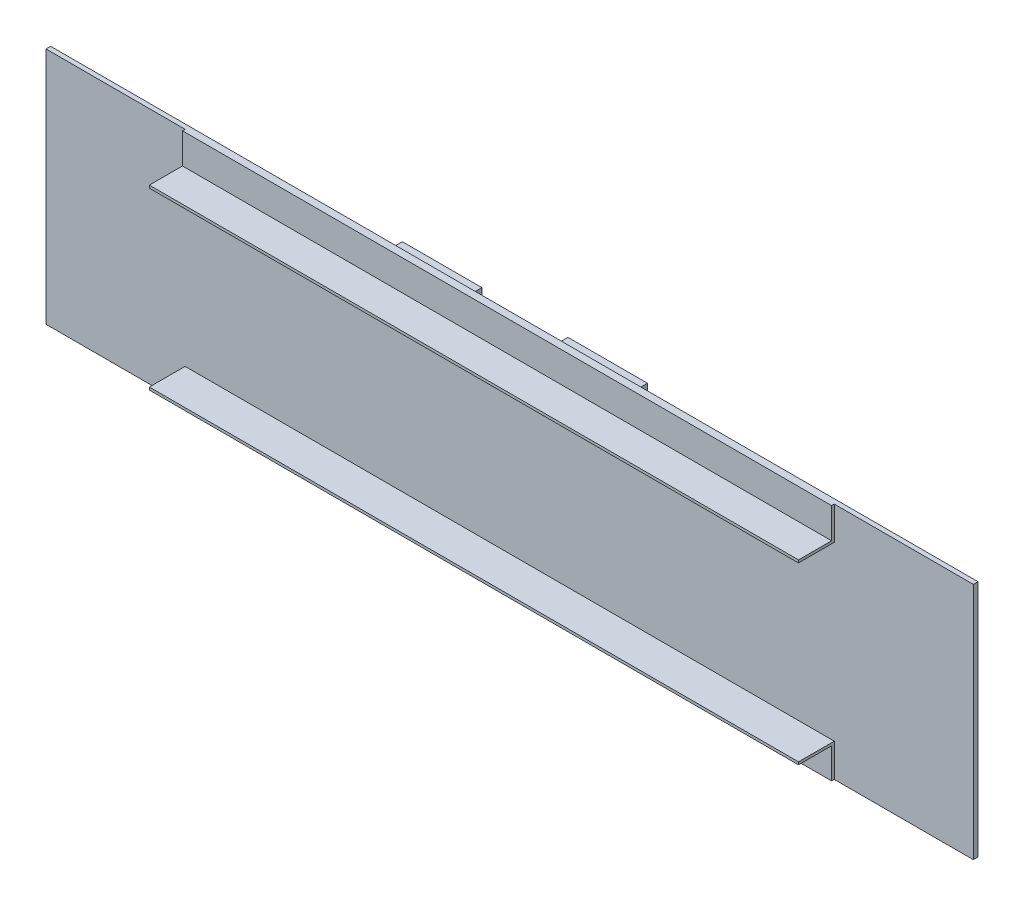
from build123d import *

# Parameters (mm, degrees)
SKETCH_1_W               = 2800
SKETCH_1_H               = 720
EXTRUDE_1_DEPTH          = 14
SKETCH_5_W               = 980
SKETCH_5_H               = 100
EXTRUDE_2_DEPTH          = 8
SKETCH_9_W               = 980
SKETCH_9_H               = 8
EXTRUDE_3_DEPTH          = 100
MIRROR_4_COPY_1_SKETCH_W = 980
MIRROR_4_COPY_1_SKETCH_H = 100
MIRROR_4_COPY_1_DEPTH    = 8
MIRROR_4_COPY_2_SKETCH_W = 980
MIRROR_4_COPY_2_SKETCH_H = 8
MIRROR_4_COPY_2_DEPTH    = 100
MIRROR_4_COPY_3_SKETCH_W = 980
MIRROR_4_COPY_3_SKETCH_H = 100
MIRROR_4_COPY_3_DEPTH    = 8
MIRROR_4_COPY_4_SKETCH_W = 980
MIRROR_4_COPY_4_SKETCH_H = 8
MIRROR_4_COPY_4_DEPTH    = 100
SKETCH_11_W              = 240
SKETCH_11_H              = 80
EXTRUDE_4_DEPTH          = 32
SKETCH_12_R              = 13
CUT_EXTRUDE_5_DEPTH      = 1449.999654934
PATTERN_LINEAR_4_COUNT   = 3
PATTERN_LINEAR_4_PITCH   = 80
SKETCH_11_3_W            = 240
SKETCH_11_3_H            = 80
EXTRUDE_6_DEPTH          = 54
MIRROR_8_COPY_1_SKETCH_W = 240
MIRROR_8_COPY_1_SKETCH_H = 80
MIRROR_8_COPY_1_DEPTH    = 54
MIRROR_8_COPY_2_SKETCH_W = 240
MIRROR_8_COPY_2_SKETCH_H = 80
MIRROR_8_COPY_2_DEPTH    = 54


with BuildPart() as part:
    # 草图1 → 凸台-拉伸1 (new body)
    with BuildSketch(Plane.XY):
        Rectangle(SKETCH_1_W, SKETCH_1_H)
    extrude(amount=EXTRUDE_1_DEPTH)

    # 草图5 → 凸台-拉伸2 (add)
    with BuildSketch(Plane.XY.offset(14)):
        with Locations((-490, 310)):
            Rectangle(SKETCH_5_W, SKETCH_5_H)
    extrude_2 = extrude(amount=EXTRUDE_2_DEPTH)

    # 草图9 → 凸台-拉伸3 (add)
    with BuildSketch(Plane.XY.offset(22)):
        with Locations((-490, 264)):
            Rectangle(SKETCH_9_W, SKETCH_9_H)
    extrude_3 = extrude(amount=EXTRUDE_3_DEPTH)

    # 镜向3: 凸台-拉伸2, 凸台-拉伸3 across plane
    add(extrude_2.mirror(Plane.ZX))
    add(extrude_3.mirror(Plane.ZX))

    # 镜向4 copy 1 sketch → 镜向4 copy 1 (add)
    with BuildSketch(Plane(origin=(0, 0, 14), x_dir=(-1, 0, 0), z_dir=(0, 0, 1))):
        with Locations((-490, 310)):
            Rectangle(MIRROR_4_COPY_1_SKETCH_W, MIRROR_4_COPY_1_SKETCH_H)
    extrude(amount=MIRROR_4_COPY_1_DEPTH)

    # 镜向4 copy 2 sketch → 镜向4 copy 2 (add)
    with BuildSketch(Plane(origin=(0, 0, 22), x_dir=(-1, 0, 0), z_dir=(0, 0, 1))):
        with Locations((-490, 264)):
            Rectangle(MIRROR_4_COPY_2_SKETCH_W, MIRROR_4_COPY_2_SKETCH_H)
    extrude(amount=MIRROR_4_COPY_2_DEPTH)

    # 镜向4 copy 3 sketch → 镜向4 copy 3 (add)
    with BuildSketch(Plane(origin=(0, 0, 14), x_dir=(-1, 0, 0), z_dir=(0, 0, 1))):
        with Locations((-490, -310)):
            Rectangle(MIRROR_4_COPY_3_SKETCH_W, MIRROR_4_COPY_3_SKETCH_H)
    extrude(amount=MIRROR_4_COPY_3_DEPTH)

    # 镜向4 copy 4 sketch → 镜向4 copy 4 (add)
    with BuildSketch(Plane(origin=(0, 0, 22), x_dir=(-1, 0, 0), z_dir=(0, 0, 1))):
        with Locations((-490, -264)):
            Rectangle(MIRROR_4_COPY_4_SKETCH_W, MIRROR_4_COPY_4_SKETCH_H)
    extrude(amount=MIRROR_4_COPY_4_DEPTH)

    # 草图11 → 凸台-拉伸4 (add)
    with BuildSketch(Plane.XY.offset(22)):
        with Locations((-250, 308)):
            Rectangle(SKETCH_11_W, SKETCH_11_H)
    extrude(amount=-EXTRUDE_4_DEPTH)

    # 草图12 → 切除-拉伸5 (cut, through all)
    with BuildSketch(Plane.XY.offset(22)):
        with Locations((-330, 304)):
            Circle(SKETCH_12_R)
    cut_extrude_5 = extrude(amount=-CUT_EXTRUDE_5_DEPTH, mode=Mode.SUBTRACT)

    # 阵列(线性)4: 切除-拉伸5 ×3
    with Locations(*[(i * PATTERN_LINEAR_4_PITCH, 0, 0) for i in range(1, PATTERN_LINEAR_4_COUNT)]):
        add(cut_extrude_5, mode=Mode.SUBTRACT)

    # 草图11<3> → 凸台-拉伸6 (add)
    with BuildSketch(Plane.XY.offset(22)):
        with Locations((-250, 308)):
            Rectangle(SKETCH_11_3_W, SKETCH_11_3_H)
    extrude_6 = extrude(amount=-EXTRUDE_6_DEPTH)

    # 镜向7: 凸台-拉伸6 across plane
    add(extrude_6.mirror(Plane.ZX))

    # 镜向8 copy 1 sketch → 镜向8 copy 1 (add)
    with BuildSketch(Plane(origin=(0, 0, 22), x_dir=(-1, 0, 0), z_dir=(0, 0, 1))):
        with Locations((-250, 308)):
            Rectangle(MIRROR_8_COPY_1_SKETCH_W, MIRROR_8_COPY_1_SKETCH_H)
    extrude(amount=-MIRROR_8_COPY_1_DEPTH)

    # 镜向8 copy 2 sketch → 镜向8 copy 2 (add)
    with BuildSketch(Plane(origin=(0, 0, 22), x_dir=(-1, 0, 0), z_dir=(0, 0, 1))):
        with Locations((-250, -308)):
            Rectangle(MIRROR_8_COPY_2_SKETCH_W, MIRROR_8_COPY_2_SKETCH_H)
    extrude(amount=-MIRROR_8_COPY_2_DEPTH)


solid = part.part
